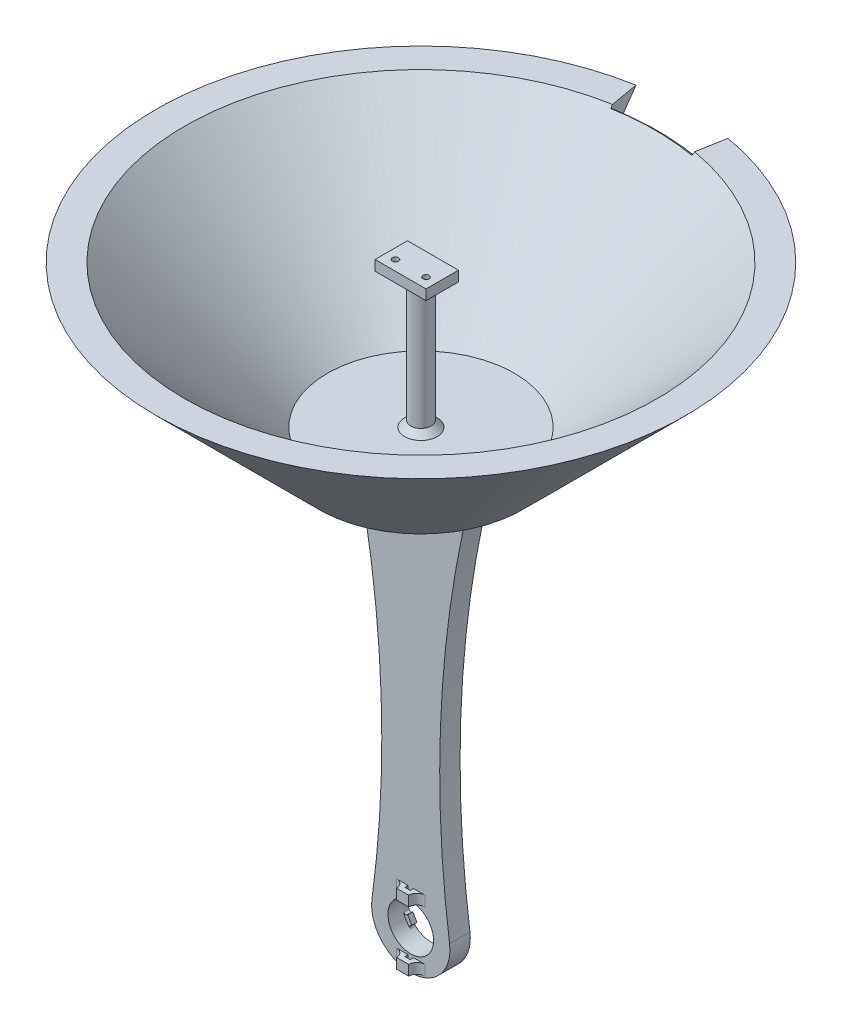
from build123d import *

# Parameters (mm, degrees)
SKETCH1_R               = 19.2
SKETCH1_R_2             = 11.2
BOSS_EXTRUDE1_DEPTH     = 10
SKETCH3_W               = 3
SKETCH3_H               = 5
SKETCH3_W_2             = 6
BOSS_EXTRUDE3_DEPTH     = 4
FILLET6_R               = 4
CUT_EXTRUDE1_DEPTH      = 186.773625685
CUT_EXTRUDE1_DEPTH_BACK = 186.773625685
SKETCH5_W               = 2.6
SKETCH5_H               = 1.6
FILLET7_R               = 20
SKETCH7_R               = 5
BOSS_EXTRUDE4_DEPTH     = 65
SKETCH8_W               = 25
SKETCH8_H               = 20
BOSS_EXTRUDE5_DEPTH     = 5
SKETCH10_R              = 1.5
CUT_EXTRUDE2_DEPTH      = 5
FILLET8_R               = 1
SKETCH2_W               = 4
SKETCH2_H               = 4
BOSS_EXTRUDE6_DEPTH     = 2.5
CIRPATTERN1_COUNT       = 3
FILLET9_R               = 1
CUT_REVOLVE1_ANGLE      = 20
CUT_EXTRUDE3_REACH      = 355.052
SKETCH14_W              = 25
SKETCH14_H              = 4.1


with BuildPart() as part:
    # Sketch1 → Boss-Extrude1 (new body)
    # profile 1 of 2: a face of its own
    with BuildSketch(Plane.XY):
        with BuildLine():
            Line((30, 200), (-30, 200))
            ThreePointArc((-30, 200), (-15, 101.836029472), (-19.021213884, 2.614081554))
            ThreePointArc((-19.021213884, 2.614081554), (0, 19.2), (19.021213884, 2.614081554))
            ThreePointArc((19.021213884, 2.614081554), (15, 101.836029472), (30, 200))
        make_face()
    # profile 2 of 2: a face of its own
    with BuildSketch(Plane.XY):
        Circle(SKETCH1_R)
        Circle(SKETCH1_R_2, mode=Mode.SUBTRACT)
    extrude(amount=BOSS_EXTRUDE1_DEPTH)

    # Sketch3 → Boss-Extrude3 (add)
    with BuildSketch(Plane.XY.offset(10)):
        with Locations((1.5, 14.7)):
            Rectangle(SKETCH3_W, SKETCH3_H)
        with Locations((-1.5, 14.7)):
            Rectangle(SKETCH3_W, SKETCH3_H)
        with Locations((0, -14.7)):
            Rectangle(SKETCH3_W_2, SKETCH3_H)
    extrude(amount=BOSS_EXTRUDE3_DEPTH)

    # Fillet6
    fillet6_edges = [part.edges().sort_by_distance(p)[0] for p in [
        (-3, -14.7, 10),
        (3, -14.7, 10),
        (3, 14.7, 10),
        (-3, 14.7, 10),
    ]]
    fillet(fillet6_edges, radius=FILLET6_R - 0.0001)  # a hair under: the kernel refuses the full size

    # Sketch5 → Cut-Extrude1 (cut, two sides: drawn at the far end of the back side and taken through both)
    with BuildSketch(Plane(origin=(0, 17.2, 0), x_dir=(1, 0, 0), z_dir=(0, 1, 0)).offset(-CUT_EXTRUDE1_DEPTH_BACK)):
        with Locations((0, -10.8)):
            Rectangle(SKETCH5_W, SKETCH5_H)
    extrude(amount=CUT_EXTRUDE1_DEPTH + CUT_EXTRUDE1_DEPTH_BACK, mode=Mode.SUBTRACT)

    # Sketch6 → Revolve1 (revolve)
    with BuildSketch(Plane(origin=(0, 0, 0), x_dir=(0, 0, -1), z_dir=(1, 0, 0))):
        Polygon((-5, 210), (-5, 200), (45, 200), (125, 280), (110.857864376, 280), (100.857864376, 270), (40.857864376, 210), (5, 210), align=None)
    revolve(axis=Axis((0, 200, 5), (0, 1, 0)))

    # Fillet7
    fillet7_edges = [part.edges().sort_by_distance(p)[0] for p in [
        (0, 200, 10),
        (0, 200, 0),
    ]]
    fillet(fillet7_edges, radius=FILLET7_R)



with BuildPart() as body_2:
    # Sketch7 → Boss-Extrude4 (new body)
    with BuildSketch(Plane(origin=(0, 210, 0), x_dir=(1, 0, 0), z_dir=(0, 1, 0))):
        with Locations(Location((0, -5, 0), (0, 0, 270))):
            Circle(SKETCH7_R)
    extrude(amount=BOSS_EXTRUDE4_DEPTH)

    # Sketch8 → Boss-Extrude5 (add)
    with BuildSketch(Plane(origin=(0, 275, 0), x_dir=(1, 0, 0), z_dir=(0, 1, 0))):
        with Locations((0, -5)):
            Rectangle(SKETCH8_W, SKETCH8_H)
    extrude(amount=BOSS_EXTRUDE5_DEPTH)

    # Sketch10 → Cut-Extrude2 (cut)
    with BuildSketch(Plane(origin=(0, 280, 0), x_dir=(1, 0, 0), z_dir=(0, 1, 0))):
        with Locations(Location((-7.5, -10, 0), (0, 0, 270))):
            Circle(SKETCH10_R)
        with Locations(Location((7.5, -10, 0), (0, 0, 270))):
            Circle(SKETCH10_R)
    extrude(amount=-CUT_EXTRUDE2_DEPTH, mode=Mode.SUBTRACT)

    # Fillet8
    fillet8_edges = [body_2.edges().sort_by_distance(p)[0] for p in [
        (0, 275, 0),
    ]]
    fillet(fillet8_edges, radius=FILLET8_R)


with BuildPart() as part_1:
    add(part.part)

    add(body_2.part)  # Revolve2 merges body 2
    # Sketch12 → Revolve2 (revolve)
    with BuildSketch(Plane.XY.offset(5), mode=Mode.PRIVATE) as revolve2_sk:
        Polygon((5, 210), (5, 213), (8, 210), align=None)
    revolve(revolve2_sk.sketch.rotate(Axis((0, 210, 5), (0, 1, 0)), 90), axis=Axis((0, 210, 5), (0, 1, 0)))

    # Sketch2 → Boss-Extrude6 (add)
    with BuildSketch(Plane(origin=(0, 0, 0), x_dir=(-1, 0, 0), z_dir=(0, 0, -1))):
        with Locations((0, 11.2)):
            Rectangle(SKETCH2_W, SKETCH2_H)
    boss_extrude6 = extrude(amount=-BOSS_EXTRUDE6_DEPTH)

    # CirPattern1: Boss-Extrude6 ×3 about axis
    cirpattern1_axis = Axis((0, 0, 0), (0, 0, 1))
    for i in range(1, CIRPATTERN1_COUNT):
        add(boss_extrude6.rotate(cirpattern1_axis, i * 360 / CIRPATTERN1_COUNT))

    # Fillet9
    fillet9_edges = [part_1.edges().sort_by_distance(p)[0] for p in [
        (-2, 11.019981851, 1.25),
        (2, 11.019981851, 1.25),
        (10.543584232, -3.777940118, 1.25),
        (8.543584232, -7.242041733, 1.25),
        (-8.543584232, -7.242041733, 1.25),
        (-10.543584232, -3.777940118, 1.25),
    ]]
    fillet(fillet9_edges, radius=FILLET9_R)

    # Sketch13 → Cut-Revolve1 (revolve, symmetric, cut)
    with BuildSketch(Plane(origin=(0, 0, 0), x_dir=(0, 0, -1), z_dir=(1, 0, 0))) as cut_revolve1_sk:
        with BuildLine():
            ThreePointArc((111.343145751, 266.343145751), (113.077327761, 275.061467459), (105.686291501, 280))
            Line((105.686291501, 280), (125, 280))
            Line((125, 280), (111.343145751, 266.343145751))
        make_face()
    revolve(axis=Axis((0, 274, 5), (0, -1, 0)), revolution_arc=CUT_REVOLVE1_ANGLE / 2, mode=Mode.SUBTRACT)
    revolve(cut_revolve1_sk.sketch, axis=Axis((0, 274, 5), (0, 1, 0)), revolution_arc=CUT_REVOLVE1_ANGLE / 2, mode=Mode.SUBTRACT)

    # Sketch14 → Cut-Extrude3 (cut, up to next)
    with BuildSketch(Plane(origin=(0, 280, 0), x_dir=(1, 0, 0), z_dir=(0, 1, 0)), mode=Mode.PRIVATE) as cut_extrude3_sk1:
        with Locations((0, 2.95)):
            Rectangle(SKETCH14_W, SKETCH14_H)
    cut_extrude3_tool1 = extrude(cut_extrude3_sk1.sketch, amount=-CUT_EXTRUDE3_REACH, mode=Mode.PRIVATE) & part_1.part
    add(cut_extrude3_tool1.solids().sort_by_distance((0, 280, -2.95))[0], mode=Mode.SUBTRACT)


solid = part_1.part
